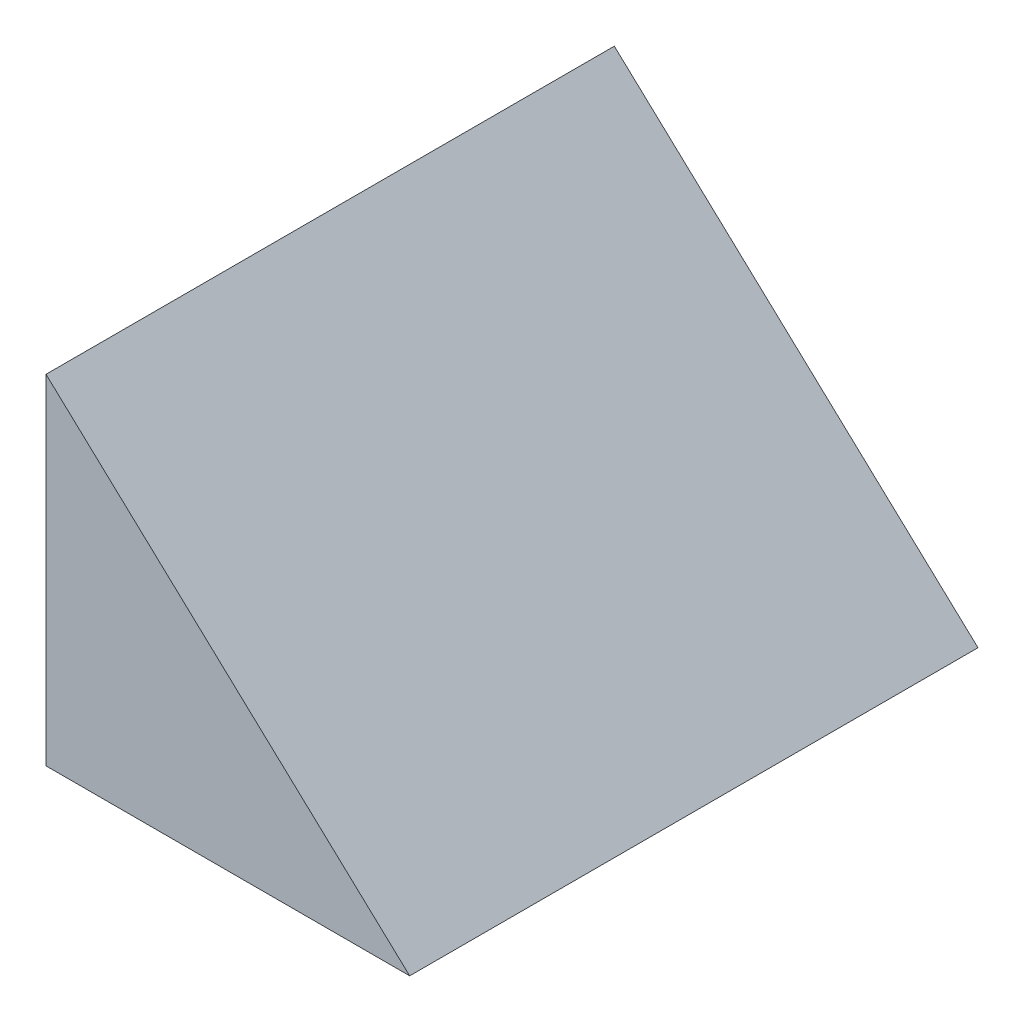
from build123d import *

# Parameters (mm, degrees)
BOSS_EXTRUDE1_DEPTH = 40
SKETCH3_R           = 1.5
CUT_EXTRUDE1_DEPTH  = 7
SKETCH6_W           = 37
SKETCH6_H           = 12
CUT_EXTRUDE2_DEPTH  = 10
SKETCH7_W           = 36
SKETCH7_H           = 10
CUT_EXTRUDE3_DEPTH  = 3.5
SKETCH8_W           = 33
SKETCH8_H           = 4.869942602
CUT_EXTRUDE4_DEPTH  = 3
SKETCH9_W           = 30
SKETCH9_H           = 2.869942602
CUT_EXTRUDE5_DEPTH  = 2


with BuildPart() as part:
    # Sketch1 → Boss-Extrude1 (new body)
    with BuildSketch(Plane.XY):
        Polygon((0, 0), (25.597379557, 0), (0, 23.869942602), align=None)
    extrude(amount=-BOSS_EXTRUDE1_DEPTH)

    # Sketch3 → Cut-Extrude1 (cut)
    with BuildSketch(Plane.XZ):
        with Locations((12.8, -20)):
            Circle(SKETCH3_R)
    extrude(amount=-CUT_EXTRUDE1_DEPTH, mode=Mode.SUBTRACT)

    # Sketch6 → Cut-Extrude2 (cut)
    with BuildSketch(Plane.ZY):
        with Locations((-20, 6)):
            Rectangle(SKETCH6_W, SKETCH6_H)
    extrude(amount=-CUT_EXTRUDE2_DEPTH, mode=Mode.SUBTRACT)

    # Sketch7 → Cut-Extrude3 (cut)
    with BuildSketch(Plane.ZY):
        with Locations((-20, 14.869942602)):
            Rectangle(SKETCH7_W, SKETCH7_H)
    extrude(amount=-CUT_EXTRUDE3_DEPTH, mode=Mode.SUBTRACT)

    # Sketch8 → Cut-Extrude4 (cut)
    with BuildSketch(Plane.ZY.offset(-3.5)):
        with Locations((-20, 14.434971301)):
            Rectangle(SKETCH8_W, SKETCH8_H)
    extrude(amount=-CUT_EXTRUDE4_DEPTH, mode=Mode.SUBTRACT)

    # Sketch9 → Cut-Extrude5 (cut)
    with BuildSketch(Plane.ZY.offset(-6.5)):
        with Locations((-20, 13.434971301)):
            Rectangle(SKETCH9_W, SKETCH9_H)
    extrude(amount=-CUT_EXTRUDE5_DEPTH, mode=Mode.SUBTRACT)


solid = part.part
